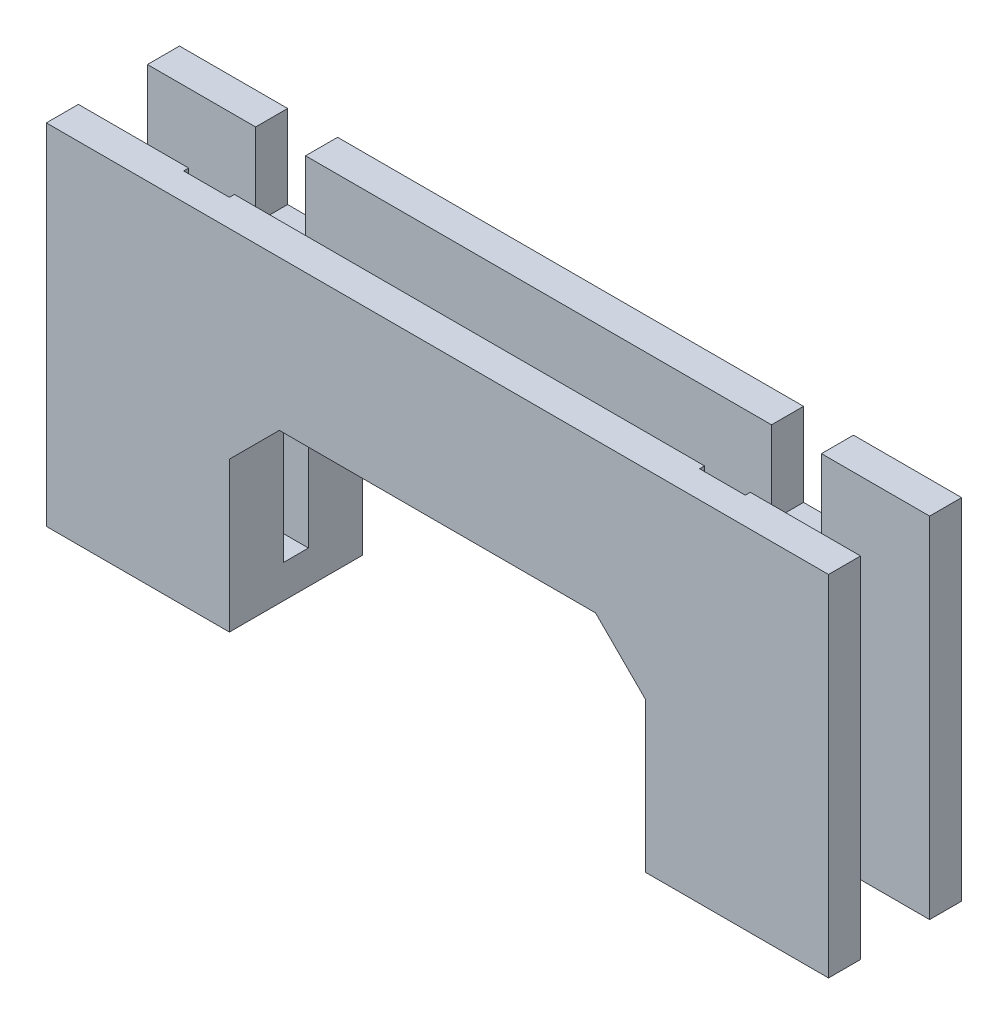
from build123d import *

# Parameters (mm, degrees)
EXTRUDE_1_DEPTH     = 8
CUT_EXTRUDE_START   = -1
SKETCH_2_W          = 2.75
SKETCH_2_H          = 4.75
SKETCH_2_W_2        = 1.625
SKETCH_2_H_2        = 1.5
CUT_EXTRUDE_1_DEPTH = 25.734218465
SKETCH_3_W          = 0.5
SKETCH_3_H          = 1.625
EXTRUDE_2_DEPTH     = 2
CHAMFER_1_SIZE      = 1
SKETCH_4_W          = 1.625
SKETCH_4_H          = 1.5
EXTRUDE_3_DEPTH     = 1
CHAMFER_2_SIZE      = 3
SKETCH_5_W          = 5
SKETCH_5_H          = 1.925
EXTRUDE_4_DEPTH     = 16
SKETCH_6_W          = 6.5
SKETCH_6_H          = 1.925
SKETCH_6_W_2        = 28
EXTRUDE_5_DEPTH     = 5
SKETCH_7_R          = 1.75
CUT_EXTRUDE_2_DEPTH = 28.572631358


with BuildPart() as part:
    # Эскиз1 → Бобышка-Вытянуть1 (new body)
    with BuildSketch(Plane.XY):
        Polygon((-18.5, -6), (-12.5, -6), (-12.5, 6), (12.5, 6), (12.5, -6), (18.5, -6), (18.5, 10), (-18.5, 10), align=None)
    extrude(amount=EXTRUDE_1_DEPTH)

    # Эскиз2 → Вырез-Вытянуть1 (cut, through all)
    with BuildSketch(Plane.XZ.offset(6).offset(CUT_EXTRUDE_START)):
        with Locations((15.5, 4)):
            Rectangle(SKETCH_2_W, SKETCH_2_H)
        with Locations((13.3125, 4)):
            Rectangle(SKETCH_2_W_2, SKETCH_2_H_2)
        with Locations((-13.3125, 4)):
            Rectangle(SKETCH_2_W_2, SKETCH_2_H_2)
        Polygon((-14.125, 1.625), (-14.125, 3.25), (-14.125, 4.75), (-14.125, 6.375), (-16.875, 6.375), (-16.875, 1.625), align=None)
    extrude(amount=-CUT_EXTRUDE_1_DEPTH, mode=Mode.SUBTRACT)

    # Эскиз3 → Бобышка-Вытянуть2 (add)
    with BuildSketch(Plane(origin=(0, -5, 0), x_dir=(1, 0, 0), z_dir=(0, 1, 0))):
        with Locations((-14.375, -2.4375)):
            Rectangle(SKETCH_3_W, SKETCH_3_H)
        with Locations((-14.375, -5.5625)):
            Rectangle(SKETCH_3_W, SKETCH_3_H)
        with Locations((14.375, -5.5625)):
            Rectangle(SKETCH_3_W, SKETCH_3_H)
        with Locations((14.375, -2.4375)):
            Rectangle(SKETCH_3_W, SKETCH_3_H)
    extrude(amount=EXTRUDE_2_DEPTH)

    # Фаска1
    # the kernel refuses this chamfer: 1 mm, written as the material it adds along each edge
    with BuildSketch(Plane(origin=(-14.125, -3, 2.178317012), x_dir=(0.02749587661058563, 0.9996219169112968, 0), z_dir=(0, 0, 1))) as chamfer_1_piece_1_section:
        Polygon((CHAMFER_1_SIZE * 0.999621916911, CHAMFER_1_SIZE * 0.0274958766106), (-CHAMFER_1_SIZE * 0.0274958766106, CHAMFER_1_SIZE * 0.999621916911), (0, 0), align=None)
    chamfer_1_piece_1 = extrude(amount=6.768365976, mode=Mode.PRIVATE)
    chamfer_1_piece_1 = split(chamfer_1_piece_1, bisect_by=Plane(origin=(-14.625, -2.611111111, 2.714158506), z_dir=(1, 0, 0)), keep=Keep.TOP, mode=Mode.PRIVATE)
    chamfer_1_piece_1 = split(chamfer_1_piece_1, bisect_by=Plane(origin=(-14.347222222, -2.611111111, 3.25), z_dir=(0, 0, -1)), keep=Keep.TOP, mode=Mode.PRIVATE)
    add(chamfer_1_piece_1)
    with BuildSketch(Plane(origin=(-14.125, -3, 4.75), x_dir=(0.027495876610583895, 0.9996219169112968, 0), z_dir=(0, 0, 1))) as chamfer_1_piece_2_section:
        Polygon((CHAMFER_1_SIZE * 0.999621916911, CHAMFER_1_SIZE * 0.0274958766106), (-CHAMFER_1_SIZE * 0.0274958766106, CHAMFER_1_SIZE * 0.999621916911), (0, 0), align=None)
    chamfer_1_piece_2 = extrude(amount=1.625, mode=Mode.PRIVATE)
    chamfer_1_piece_2 = split(chamfer_1_piece_2, bisect_by=Plane(origin=(-14.625, -2.611111111, 5.5625), z_dir=(1, 0, 0)), keep=Keep.TOP, mode=Mode.PRIVATE)
    add(chamfer_1_piece_2)
    with BuildSketch(Plane(origin=(14.125, -3, 2.178317012), x_dir=(0.9996219169112968, -0.02749587661058651, -1.092729371642936e-15), z_dir=(0, 0, 1))) as chamfer_1_piece_3_section:
        Polygon((CHAMFER_1_SIZE * 0.999621916911, CHAMFER_1_SIZE * 0.0274958766106), (-CHAMFER_1_SIZE * 0.0274958766106, CHAMFER_1_SIZE * 0.999621916911), (0, 0), align=None)
    chamfer_1_piece_3 = extrude(amount=6.768365976, mode=Mode.PRIVATE)
    chamfer_1_piece_3 = split(chamfer_1_piece_3, bisect_by=Plane(origin=(14.347222222, -2.611111111, 3.25), z_dir=(0, 0, -1)), keep=Keep.TOP, mode=Mode.PRIVATE)
    chamfer_1_piece_3 = split(chamfer_1_piece_3, bisect_by=Plane(origin=(14.625, -2.611111111, 2.714158506), z_dir=(-1, 0, 0)), keep=Keep.TOP, mode=Mode.PRIVATE)
    add(chamfer_1_piece_3)
    with BuildSketch(Plane(origin=(14.125, -3, 4.75), x_dir=(0.9996219169112968, -0.02749587661058651, -1.092729371642936e-15), z_dir=(0, 0, 1))) as chamfer_1_piece_4_section:
        Polygon((CHAMFER_1_SIZE * 0.999621916911, CHAMFER_1_SIZE * 0.0274958766106), (-CHAMFER_1_SIZE * 0.0274958766106, CHAMFER_1_SIZE * 0.999621916911), (0, 0), align=None)
    chamfer_1_piece_4 = extrude(amount=1.625, mode=Mode.PRIVATE)
    chamfer_1_piece_4 = split(chamfer_1_piece_4, bisect_by=Plane(origin=(14.625, -2.611111111, 5.5625), z_dir=(-1, 0, 0)), keep=Keep.TOP, mode=Mode.PRIVATE)
    add(chamfer_1_piece_4)
    with BuildSketch(Plane(origin=(14.125, -3, 5.821682988), x_dir=(0.9996219169112968, -0.02749587661058651, 0), z_dir=(0, 0, -1))) as chamfer_1_piece_5_section:
        Polygon((CHAMFER_1_SIZE * 0.999621916911, -CHAMFER_1_SIZE * 0.0274958766106), (-CHAMFER_1_SIZE * 0.0274958766106, -CHAMFER_1_SIZE * 0.999621916911), (0, 0), align=None)
    chamfer_1_piece_5 = extrude(amount=6.768365976, mode=Mode.PRIVATE)
    chamfer_1_piece_5 = split(chamfer_1_piece_5, bisect_by=Plane(origin=(14.625, -2.611111111, 5.285841494), z_dir=(-1, 0, 0)), keep=Keep.TOP, mode=Mode.PRIVATE)
    chamfer_1_piece_5 = split(chamfer_1_piece_5, bisect_by=Plane(origin=(14.347222222, -2.611111111, 4.75), z_dir=(0, 0, 1)), keep=Keep.TOP, mode=Mode.PRIVATE)
    add(chamfer_1_piece_5)
    with BuildSketch(Plane(origin=(14.125, -3, 3.25), x_dir=(0.9996219169112968, -0.02749587661058651, 0), z_dir=(0, 0, -1))) as chamfer_1_piece_6_section:
        Polygon((CHAMFER_1_SIZE * 0.999621916911, -CHAMFER_1_SIZE * 0.0274958766106), (-CHAMFER_1_SIZE * 0.0274958766106, -CHAMFER_1_SIZE * 0.999621916911), (0, 0), align=None)
    chamfer_1_piece_6 = extrude(amount=4.196682988, mode=Mode.PRIVATE)
    chamfer_1_piece_6 = split(chamfer_1_piece_6, bisect_by=Plane(origin=(14.625, -2.611111111, 2.4375), z_dir=(-1, 0, 0)), keep=Keep.TOP, mode=Mode.PRIVATE)
    chamfer_1_piece_6 = split(chamfer_1_piece_6, bisect_by=Plane(origin=(14.347222222, -2.611111111, 0), z_dir=(0, 0, 1)), keep=Keep.TOP, mode=Mode.PRIVATE)
    add(chamfer_1_piece_6)
    with BuildSketch(Plane(origin=(-14.125, -3, 5.821682988), x_dir=(0.02749587661058563, 0.9996219169112968, 0), z_dir=(0, 0, -1))) as chamfer_1_piece_7_section:
        Polygon((CHAMFER_1_SIZE * 0.999621916911, -CHAMFER_1_SIZE * 0.0274958766106), (-CHAMFER_1_SIZE * 0.0274958766106, -CHAMFER_1_SIZE * 0.999621916911), (0, 0), align=None)
    chamfer_1_piece_7 = extrude(amount=6.768365976, mode=Mode.PRIVATE)
    chamfer_1_piece_7 = split(chamfer_1_piece_7, bisect_by=Plane(origin=(-14.347222222, -2.611111111, 4.75), z_dir=(0, 0, 1)), keep=Keep.TOP, mode=Mode.PRIVATE)
    chamfer_1_piece_7 = split(chamfer_1_piece_7, bisect_by=Plane(origin=(-14.625, -2.611111111, 5.285841494), z_dir=(1, 0, 0)), keep=Keep.TOP, mode=Mode.PRIVATE)
    add(chamfer_1_piece_7)
    with BuildSketch(Plane(origin=(-14.125, -3, 3.25), x_dir=(0.02749587661058563, 0.9996219169112968, 0), z_dir=(0, 0, -1))) as chamfer_1_piece_8_section:
        Polygon((CHAMFER_1_SIZE * 0.999621916911, -CHAMFER_1_SIZE * 0.0274958766106), (-CHAMFER_1_SIZE * 0.0274958766106, -CHAMFER_1_SIZE * 0.999621916911), (0, 0), align=None)
    chamfer_1_piece_8 = extrude(amount=4.196682988, mode=Mode.PRIVATE)
    chamfer_1_piece_8 = split(chamfer_1_piece_8, bisect_by=Plane(origin=(-14.625, -2.611111111, 2.4375), z_dir=(1, 0, 0)), keep=Keep.TOP, mode=Mode.PRIVATE)
    chamfer_1_piece_8 = split(chamfer_1_piece_8, bisect_by=Plane(origin=(-14.347222222, -2.611111111, 0), z_dir=(0, 0, 1)), keep=Keep.TOP, mode=Mode.PRIVATE)
    add(chamfer_1_piece_8)

    # Эскиз4 → Бобышка-Вытянуть3 (add)
    with BuildSketch(Plane(origin=(0, -5, 0), x_dir=(1, 0, 0), z_dir=(0, 1, 0))):
        with Locations((-13.3125, -4)):
            Rectangle(SKETCH_4_W, SKETCH_4_H)
        with Locations((13.3125, -4)):
            Rectangle(SKETCH_4_W, SKETCH_4_H)
    extrude(amount=EXTRUDE_3_DEPTH)

    # Фаска2
    chamfer_2_edges = [part.edges().sort_by_distance(p)[0] for p in [
        (12.5, 6, 6.375),
        (-12.5, 6, 6.375),
        (12.5, 6, 1.625),
        (-12.5, 6, 1.625),
    ]]
    chamfer(chamfer_2_edges, length=CHAMFER_2_SIZE)

    # Эскиз5 → Бобышка-Вытянуть4 (add, through all)
    with BuildSketch(Plane.XZ.offset(6)):
        with Locations((-21, 7.0375)):
            Rectangle(SKETCH_5_W, SKETCH_5_H)
        with Locations((-21, 0.9625)):
            Rectangle(SKETCH_5_W, SKETCH_5_H)
        with Locations((21, 7.0375)):
            Rectangle(SKETCH_5_W, SKETCH_5_H)
        with Locations((21, 0.9625)):
            Rectangle(SKETCH_5_W, SKETCH_5_H)
    extrude(amount=-EXTRUDE_4_DEPTH)

    # Эскиз6 → Бобышка-Вытянуть5 (add)
    with BuildSketch(Plane(origin=(0, 10, 0), x_dir=(1, 0, 0), z_dir=(0, 1, 0))):
        with Locations((-20.25, -0.9625)):
            Rectangle(SKETCH_6_W, SKETCH_6_H)
        with Locations((0, -0.9625)):
            Rectangle(SKETCH_6_W_2, SKETCH_6_H)
        with Locations((20.25, -0.9625)):
            Rectangle(SKETCH_6_W, SKETCH_6_H)
        Polygon((-16.875, -6.375), (-16.875, -6.075), (-23.5, -6.075), (-23.5, -8), (23.5, -8), (23.5, -6.075), (16.875, -6.075), (16.875, -6.375), (14.125, -6.375), (14.125, -6.075), (-14.125, -6.075), (-14.125, -6.375), align=None)
    extrude(amount=EXTRUDE_5_DEPTH)

    # Эскиз7 → Вырез-Вытянуть2 (cut, through all)
    with BuildSketch(Plane.XZ.offset(-6)):
        with Locations((-6.25, 4)):
            Circle(SKETCH_7_R)
        with Locations((6.25, 4)):
            Circle(SKETCH_7_R)
    extrude(amount=-CUT_EXTRUDE_2_DEPTH, mode=Mode.SUBTRACT)


solid = part.part
